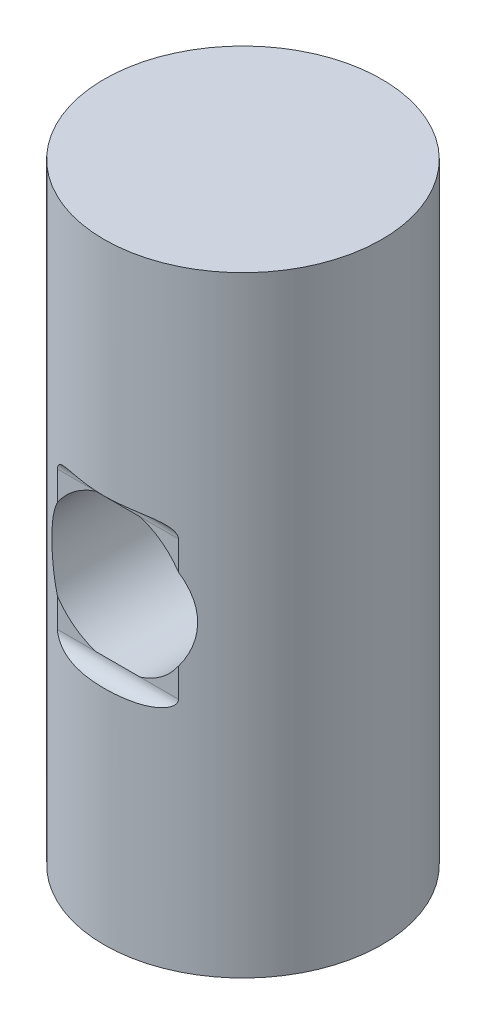
from build123d import *

# Parameters (mm, degrees)
SKETCH_1_R          = 10
EXTRUDE_1_DEPTH     = 22
SKETCH_4_W          = 3.52564581
SKETCH_4_H          = 12
CUT_EXTRUDE_1_DEPTH = 22
FILLET_1_R          = 1
SKETCH2_W           = 5.25
SKETCH2_H           = 19


with BuildPart() as part:
    # ｽｹｯﾁ1 → ﾎﾞｽ - 押し出し1 (new, symmetric)
    with BuildSketch(Plane(origin=(0, 0, 0), x_dir=(1, 0, 0), z_dir=(0, 1, 0))):
        with Locations(Location((0, 0, 0), (0, 0, 270))):
            Circle(SKETCH_1_R)
    extrude(amount=EXTRUDE_1_DEPTH, both=True)

    # ｽｹｯﾁ4 → ｶｯﾄ - 押し出し1 (cut, symmetric)
    with BuildSketch(Plane(origin=(0, 0, 0), x_dir=(0, 0, -1), z_dir=(1, 0, 0))):
        with Locations((-10.762822905, 0)):
            Rectangle(SKETCH_4_W, SKETCH_4_H)
        with Locations((10.762822905, 0)):
            Rectangle(SKETCH_4_W, SKETCH_4_H)
    extrude(amount=CUT_EXTRUDE_1_DEPTH, both=True, mode=Mode.SUBTRACT)

    # ﾌｨﾚｯﾄ1
    fillet_1_edges = [part.edges().sort_by_distance(p)[0] for p in [
        (0, -6, -9),
        (0, 6, -9),
        (0, -6, 9),
        (0, 6, 9),
    ]]
    fillet(fillet_1_edges, radius=FILLET_1_R - 0.0001)  # a hair under: the kernel refuses the full size

    # Sketch2 → M12x1.5 ねじ穴1 (revolve, cut)
    with BuildSketch(Plane(origin=(0, 0, 9), x_dir=(0, -1, 0), z_dir=(1, 0, 0))):
        with Locations((2.625, 9.5)):
            Rectangle(SKETCH2_W, SKETCH2_H)
    revolve(axis=Axis((0, 0, 15.35), (0, 0, -1)), mode=Mode.SUBTRACT)


solid = part.part
